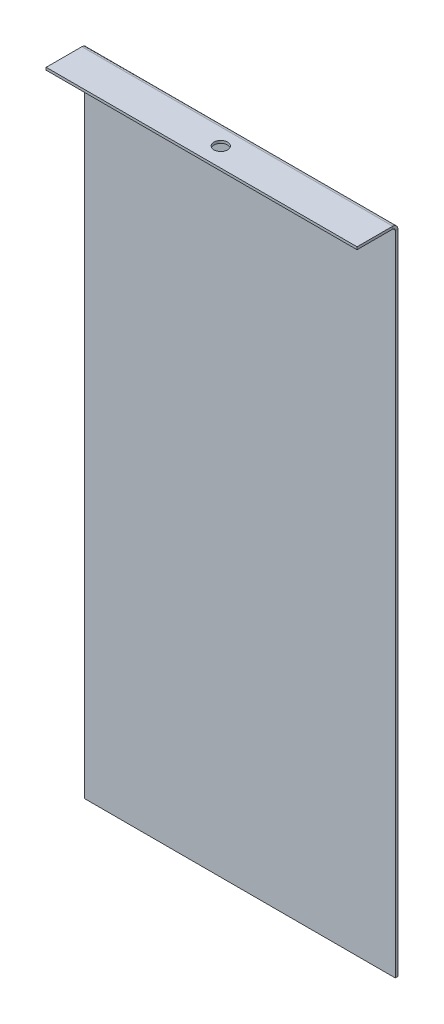
from build123d import *

# Parameters (mm, degrees)
SKETCH1_W                    = 193.675
SKETCH1_H                    = 406.4
BOSS_EXTRUDE1_DEPTH          = 1.5875
EDGE_FLANGE1_STRIP_W         = 9.525
EDGE_FLANGE1_STRIP_H         = 1.5875
EDGE_FLANGE1_STRIP_CUT_DEPTH = 193.675
EDGE_FLANGE1_DEPTH           = 193.675
SKETCH5_R                    = 4.2418
CUT_EXTRUDE1_DEPTH           = 2.54


# Sheet-metal steps are written as plain solids
with BuildPart() as part:
    # Sketch1 → Boss-Extrude1 (new body)
    with BuildSketch(Plane.XY):
        with Locations((96.8375, 203.2)):
            Rectangle(SKETCH1_W, SKETCH1_H)
    extrude(amount=BOSS_EXTRUDE1_DEPTH)

    # Edge-Flange1 strip (across the edge) → Edge-Flange1 strip cut (cut)
    with BuildSketch(Plane(origin=(193.675, 406.4, 1.5875), x_dir=(0, -1, 0), z_dir=(-1, 0, 0))):
        with Locations((-1.5875, -0.79375)):
            Rectangle(EDGE_FLANGE1_STRIP_W, EDGE_FLANGE1_STRIP_H)
    extrude(amount=EDGE_FLANGE1_STRIP_CUT_DEPTH, mode=Mode.SUBTRACT)

    # Edge-Flange1 section (across the edge) → Edge-Flange1 (add)
    with BuildSketch(Plane(origin=(193.675, 406.4, 1.5875), x_dir=(0, -1, 0), z_dir=(-1, 0, 0))):
        with BuildLine():
            Line((0, 1.5875), (0, 23.8125))
            Line((0, 23.8125), (1.5875, 23.8125))
            Line((1.5875, 23.8125), (1.5875, 1.5875))
            ThreePointArc((1.5875, 1.5875), (2.052467985, 0.464967985), (3.175, 0))
            Line((3.175, 0), (3.175, -1.5875))
            ThreePointArc((3.175, -1.5875), (0.92993597, -0.65756403), (0, 1.5875))
        make_face()
    extrude(amount=EDGE_FLANGE1_DEPTH)

    # Sketch5 → Cut-Extrude1 (cut)
    with BuildSketch(Plane(origin=(0, 406.4, 0), x_dir=(1, 0, 0), z_dir=(0, 1, 0))):
        with Locations(Location((96.8375, -13.462, 0), (0, 0, 270))):
            Circle(SKETCH5_R)
    extrude(amount=-CUT_EXTRUDE1_DEPTH, mode=Mode.SUBTRACT)


solid = part.part
